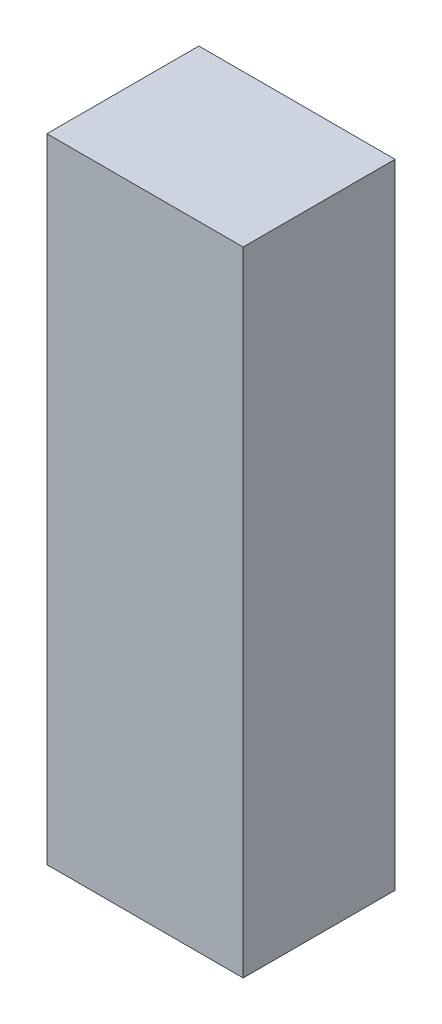
from build123d import *

# Parameters (mm, degrees)
SKETCH1_W           = 250
SKETCH1_H           = 80
BOSS_EXTRUDE1_DEPTH = 2.5
SKETCH2_W           = 80
SKETCH2_H           = 250
SKETCH2_W_2         = 75
SKETCH2_H_2         = 245
BOSS_EXTRUDE2_DEPTH = 55
SKETCH3_W           = 80
SKETCH3_H           = 250
BOSS_EXTRUDE3_DEPTH = 2.5
SKETCH4_W           = 250
SKETCH4_H           = 60
CUT_EXTRUDE1_DEPTH  = 2.5


with BuildPart() as part:
    # Sketch1 → Boss-Extrude1 (new body)
    with BuildSketch(Plane(origin=(0, 0, 0), x_dir=(0, 1, 0), z_dir=(0, 0, 1))):
        Rectangle(SKETCH1_W, SKETCH1_H)
    extrude(amount=BOSS_EXTRUDE1_DEPTH)

    # Sketch2 → Boss-Extrude2 (add)
    with BuildSketch(Plane(origin=(0, 0, 0), x_dir=(1, 0, 0), z_dir=(0, 0, -1))):
        Rectangle(SKETCH2_W, SKETCH2_H)
        Rectangle(SKETCH2_W_2, SKETCH2_H_2, mode=Mode.SUBTRACT)
    extrude(amount=BOSS_EXTRUDE2_DEPTH)

    # Sketch3 → Boss-Extrude3 (add)
    with BuildSketch(Plane(origin=(0, 0, -55), x_dir=(1, 0, 0), z_dir=(0, 0, -1))):
        Rectangle(SKETCH3_W, SKETCH3_H)
    extrude(amount=BOSS_EXTRUDE3_DEPTH)

    # Sketch4 → Cut-Extrude1 (cut)
    with BuildSketch(Plane(origin=(-40, 0, 0), x_dir=(0, -1, 0), z_dir=(-1, 0, 0))):
        with Locations((0, -27.5)):
            Rectangle(SKETCH4_W, SKETCH4_H)
    extrude(amount=-CUT_EXTRUDE1_DEPTH, mode=Mode.SUBTRACT)


solid = part.part
